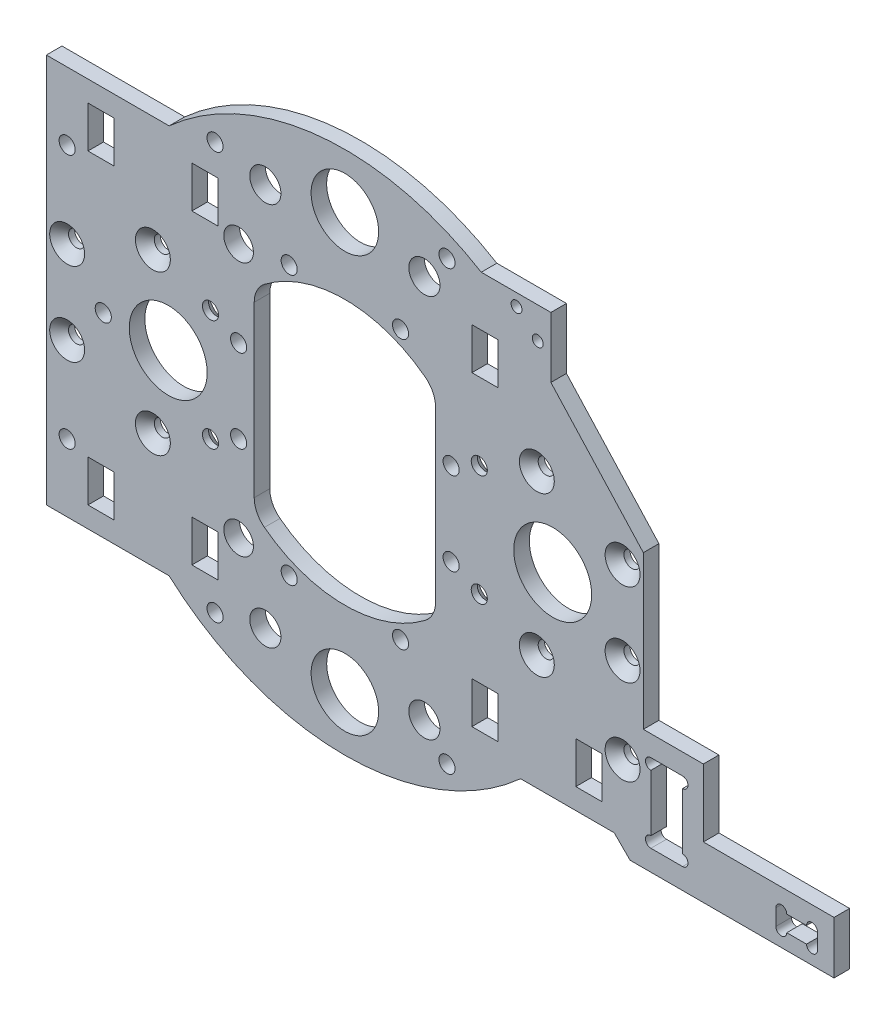
from build123d import *

# Parameters (mm, degrees)
SKETCH_1_R                  = 1.55
SKETCH_1_R_2                = 3
SKETCH_1_R_3                = 1.05
SKETCH_1_R_4                = 7.5
SKETCH_1_R_5                = 6.5
SKETCH_1_R_6                = 2.85
SKETCH_1_W                  = 5
SKETCH_1_H                  = 8
SKETCH_1_W_2                = 6.1
SKETCH_1_H_2                = 15.1
SKETCH_1_W_3                = 8
SKETCH_1_H_3                = 3.1
EXTRUDE_1_DEPTH             = 3
HOLE_WIZARD_M3_1_AT_2_COUNT = 2
HOLE_WIZARD_M3_1_AT_2_PITCH = 16
FILLET_1_R                  = 5
SKETCH_5_R                  = 1.05
CUT_EXTRUDE_1_DEPTH         = 10
SKETCH_7_R                  = 1.05
CUT_EXTRUDE_3_DEPTH         = 107.88064605


# Read off the part's stored shape, not the designer's step: M3 六角凹锥坑螺钉的锥形沉头孔2
with BuildPart() as part:
    # 草图1 → 凸台-拉伸1 (new body)
    with BuildSketch(Plane.XY):
        with BuildLine():
            Line((57.45, 12), (57.45, -12))
            Line((57.45, -12), (57.45, -17.45))
            Line((57.45, -17.45), (69, -17.45))
            Line((69, -17.45), (69, -30.45))
            Line((69, -30.45), (94.15, -30.45))
            Line((94.15, -30.45), (94.15, -40.55))
            Line((94.15, -40.55), (69, -40.55))
            Line((69, -40.55), (54.9, -40.55))
            Line((54.9, -40.55), (51.85, -37.5))
            Line((51.85, -37.5), (33.823069051, -37.5))
            ThreePointArc((33.823069051, -37.5), (0, -50.5), (-33.823069051, -37.5))
            Line((-33.823069051, -37.5), (-51.85, -37.5))
            Line((-51.85, -37.5), (-57.45, -37.5))
            Line((-57.45, -37.5), (-57.45, -17.45))
            Line((-57.45, -17.45), (-57.45, 17.45))
            Line((-57.45, 17.45), (-57.45, 37.5))
            Line((-57.45, 37.5), (-51.85, 37.5))
            Line((-51.85, 37.5), (-33.823069051, 37.5))
            ThreePointArc((-33.823069051, 37.5), (-4.723449629, 50.278613979), (26.246992614, 43.143312097))
            Line((26.246992614, 43.143312097), (39.651749171, 43.143312097))
            Line((39.651749171, 43.143312097), (39.651749171, 31.470777261))
            Line((39.651749171, 31.470777261), (57.45, 12))
        make_face()
        with Locations((-53.45, 24.5)):
            Circle(SKETCH_1_R, mode=Mode.SUBTRACT)
        with Locations((-53.45, -24.5)):
            Circle(SKETCH_1_R, mode=Mode.SUBTRACT)
        with Locations((-20.45, 8)):
            Circle(SKETCH_1_R, mode=Mode.SUBTRACT)
        with Locations((-20.45, -8)):
            Circle(SKETCH_1_R, mode=Mode.SUBTRACT)
        with Locations(Location((20.45, -8, 0), (0, 0, 180))):
            Circle(SKETCH_1_R, mode=Mode.SUBTRACT)
        with Locations(Location((20.45, 8, 0), (0, 0, 180))):
            Circle(SKETCH_1_R, mode=Mode.SUBTRACT)
        with Locations((53.45, 8)):
            Circle(SKETCH_1_R, mode=Mode.SUBTRACT)
        with Locations((53.45, -8)):
            Circle(SKETCH_1_R, mode=Mode.SUBTRACT)
        with Locations((-46.5, 0)):
            Circle(SKETCH_1_R, mode=Mode.SUBTRACT)
        with Locations((-24.984431788, 39.21770223)):
            Circle(SKETCH_1_R, mode=Mode.SUBTRACT)
        with Locations((19.651749171, 42.143312097)):
            Circle(SKETCH_1_R, mode=Mode.SUBTRACT)
        with Locations(Location((19.651749171, -42.143312097, 0), (0, 0, 180))):
            Circle(SKETCH_1_R, mode=Mode.SUBTRACT)
        with Locations(Location((-24.984431788, -39.21770223, 0), (0, 0, 180))):
            Circle(SKETCH_1_R, mode=Mode.SUBTRACT)
        with Locations((-10.715136106, 25.86862691)):
            Circle(SKETCH_1_R, mode=Mode.SUBTRACT)
        with Locations((10.715136106, 25.86862691)):
            Circle(SKETCH_1_R, mode=Mode.SUBTRACT)
        with Locations((25.86862691, 10.715136106)):
            Circle(SKETCH_1_R, mode=Mode.SUBTRACT)
        with Locations((25.86862691, -10.715136106)):
            Circle(SKETCH_1_R, mode=Mode.SUBTRACT)
        with Locations((10.715136106, -25.86862691)):
            Circle(SKETCH_1_R, mode=Mode.SUBTRACT)
        with Locations((-10.715136106, -25.86862691)):
            Circle(SKETCH_1_R, mode=Mode.SUBTRACT)
        with Locations((-25.86862691, -10.715136106)):
            Circle(SKETCH_1_R, mode=Mode.SUBTRACT)
        with Locations((-25.86862691, 10.715136106)):
            Circle(SKETCH_1_R, mode=Mode.SUBTRACT)
        with Locations((-36.95, 15.3)):
            Circle(SKETCH_1_R, mode=Mode.SUBTRACT)
        with Locations((-36.95, -15.3)):
            Circle(SKETCH_1_R, mode=Mode.SUBTRACT)
        with Locations(Location((36.95, -15.3, 0), (0, 0, 180))):
            Circle(SKETCH_1_R, mode=Mode.SUBTRACT)
        with Locations(Location((36.95, 15.3, 0), (0, 0, 180))):
            Circle(SKETCH_1_R, mode=Mode.SUBTRACT)
        with Locations((-15.307337295, 36.9551813)):
            Circle(SKETCH_1_R_2, mode=Mode.SUBTRACT)
        with Locations(Location((15.307337295, 36.9551813, 0), (0, 0, 180))):
            Circle(SKETCH_1_R_2, mode=Mode.SUBTRACT)
        with Locations(Location((-15.307337295, -36.9551813, 0), (0, 0, 180))):
            Circle(SKETCH_1_R_2, mode=Mode.SUBTRACT)
        with Locations((15.307337295, -36.9551813)):
            Circle(SKETCH_1_R_2, mode=Mode.SUBTRACT)
        with Locations((33.03932053, 40.800162976)):
            Circle(SKETCH_1_R_3, mode=Mode.SUBTRACT)
        with Locations((37.123106012, 37.123106012)):
            Circle(SKETCH_1_R_3, mode=Mode.SUBTRACT)
        with Locations((40, 0)):
            Circle(SKETCH_1_R_4, mode=Mode.SUBTRACT)
        with Locations((0, 40)):
            Circle(SKETCH_1_R_5, mode=Mode.SUBTRACT)
        with Locations(Location((0, -40, 0), (0, 0, 180))):
            Circle(SKETCH_1_R_5, mode=Mode.SUBTRACT)
        with Locations(Location((-53.45, -8, 0), (0, 0, 180))):
            Circle(SKETCH_1_R, mode=Mode.SUBTRACT)
        with Locations(Location((-53.45, 8, 0), (0, 0, 180))):
            Circle(SKETCH_1_R, mode=Mode.SUBTRACT)
        with Locations((-20.45, -24.5)):
            Circle(SKETCH_1_R_6, mode=Mode.SUBTRACT)
        with Locations(Location((-20.45, 24.5, 0), (0, 0, 180))):
            Circle(SKETCH_1_R_6, mode=Mode.SUBTRACT)
        with Locations(Location((53.45, -24.5, 0), (0, 0, 180))):
            Circle(SKETCH_1_R, mode=Mode.SUBTRACT)
        with Locations((-34, 0)):
            Circle(SKETCH_1_R_4, mode=Mode.SUBTRACT)
        with BuildLine():
            Line((-17.45, 18.594286757), (-17.45, -18.594286757))
            ThreePointArc((-17.45, -18.594286757), (0, -25.5), (17.45, -18.594286757))
            Line((17.45, -18.594286757), (17.45, 18.594286757))
            ThreePointArc((17.45, 18.594286757), (0, 25.5), (-17.45, 18.594286757))
        make_face(mode=Mode.SUBTRACT)
        with Locations((-26.95, -29.5)):
            Rectangle(SKETCH_1_W, SKETCH_1_H, mode=Mode.SUBTRACT)
        with Locations((-46.95, 29.5)):
            Rectangle(SKETCH_1_W, SKETCH_1_H, mode=Mode.SUBTRACT)
        with Locations((-46.95, -29.5)):
            Rectangle(SKETCH_1_W, SKETCH_1_H, mode=Mode.SUBTRACT)
        with Locations((-26.95, 29.5)):
            Rectangle(SKETCH_1_W, SKETCH_1_H, mode=Mode.SUBTRACT)
        with Locations((46.95, -29.5)):
            Rectangle(SKETCH_1_W, SKETCH_1_H, mode=Mode.SUBTRACT)
        with Locations((26.95, -29.5)):
            Rectangle(SKETCH_1_W, SKETCH_1_H, mode=Mode.SUBTRACT)
        with Locations((26.95, 29.5)):
            Rectangle(SKETCH_1_W, SKETCH_1_H, mode=Mode.SUBTRACT)
        with Locations((61.95, -29)):
            Rectangle(SKETCH_1_W_2, SKETCH_1_H_2, mode=Mode.SUBTRACT)
        with Locations((86.95, -36)):
            Rectangle(SKETCH_1_W_3, SKETCH_1_H_3, mode=Mode.SUBTRACT)
    extrude(amount=EXTRUDE_1_DEPTH)

    # 草图3 → M3 六角凹锥坑螺钉的锥形沉头孔1 (revolve, cut)
    with BuildSketch(Plane(origin=(-53.45, -8, 3), x_dir=(0, -1, 0), z_dir=(1, 0, 0))):
        Polygon((0, 0), (0, 3), (1.5, 3), (1.5, 1.86), (3.36, 0), align=None)
    hole_wizard_m3_1 = revolve(axis=Axis((-53.45, -8, 9.35), (0, 0, -1)), mode=Mode.SUBTRACT)

    # M3 六角凹锥坑螺钉的锥形沉头孔1 at 2: M3 六角凹锥坑螺钉的锥形沉头孔1 ×2
    with Locations(*[(0, i * HOLE_WIZARD_M3_1_AT_2_PITCH, 0) for i in range(1, HOLE_WIZARD_M3_1_AT_2_COUNT)]):
        add(hole_wizard_m3_1, mode=Mode.SUBTRACT)

    # 圆角1
    fillet_1_edges = [part.edges().sort_by_distance(p)[0] for p in [
        (17.45, 18.594286757, 1.5),
        (-17.45, 18.594286757, 1.5),
        (-17.45, -18.594286757, 1.5),
        (17.45, -18.594286757, 1.5),
    ]]
    fillet(fillet_1_edges, radius=FILLET_1_R)

    # M3 六角凹锥坑螺钉的锥形沉头孔2 outline → M3 六角凹锥坑螺钉的锥形沉头孔2 (revolve, cut)
    with BuildSketch(Plane(origin=(53.45, 8, 0), x_dir=(1, 0, 0), z_dir=(0, -1, 0))):
        Polygon((1.55, 3), (1.55, 1.19), (3.36, 3), align=None)
    revolve(axis=Axis((53.45, 8, 0), (0, 0, 1)), mode=Mode.SUBTRACT)

    # Hole Wizard M3 _2 2 outline → Hole Wizard M3 _2 2 (revolve, cut)
    with BuildSketch(Plane(origin=(53.45, -8, 0), x_dir=(1, 0, 0), z_dir=(0, -1, 0))):
        Polygon((1.55, 3), (1.55, 1.19), (3.36, 3), align=None)
    revolve(axis=Axis((53.45, -8, 0), (0, 0, 1)), mode=Mode.SUBTRACT)

    # Hole Wizard M3 _2 3 outline → Hole Wizard M3 _2 3 (revolve, cut)
    with BuildSketch(Plane(origin=(53.45, -24.5, 0), x_dir=(1, 0, 0), z_dir=(0, -1, 0))):
        Polygon((1.55, 3), (1.55, 1.19), (3.36, 3), align=None)
    revolve(axis=Axis((53.45, -24.5, 0), (0, 0, 1)), mode=Mode.SUBTRACT)

    # Hole Wizard M3 _2 4 outline → Hole Wizard M3 _2 4 (revolve, cut)
    with BuildSketch(Plane(origin=(-36.95, 15.3, 0), x_dir=(1, 0, 0), z_dir=(0, -1, 0))):
        Polygon((1.55, 3), (1.55, 1.19), (3.36, 3), align=None)
    revolve(axis=Axis((-36.95, 15.3, 0), (0, 0, 1)), mode=Mode.SUBTRACT)

    # Hole Wizard M3 _2 5 outline → Hole Wizard M3 _2 5 (revolve, cut)
    with BuildSketch(Plane(origin=(-36.95, -15.3, 0), x_dir=(1, 0, 0), z_dir=(0, -1, 0))):
        Polygon((1.55, 3), (1.55, 1.19), (3.36, 3), align=None)
    revolve(axis=Axis((-36.95, -15.3, 0), (0, 0, 1)), mode=Mode.SUBTRACT)

    # Hole Wizard M3 _2 6 outline → Hole Wizard M3 _2 6 (revolve, cut)
    with BuildSketch(Plane(origin=(36.95, 15.3, 0), x_dir=(1, 0, 0), z_dir=(0, -1, 0))):
        Polygon((1.55, 3), (1.55, 1.19), (3.36, 3), align=None)
    revolve(axis=Axis((36.95, 15.3, 0), (0, 0, 1)), mode=Mode.SUBTRACT)

    # Hole Wizard M3 _2 7 outline → Hole Wizard M3 _2 7 (revolve, cut)
    with BuildSketch(Plane(origin=(36.95, -15.3, 0), x_dir=(1, 0, 0), z_dir=(0, -1, 0))):
        Polygon((1.55, 3), (1.55, 1.19), (3.36, 3), align=None)
    revolve(axis=Axis((36.95, -15.3, 0), (0, 0, 1)), mode=Mode.SUBTRACT)

    # Hole Wizard M3 _2 8 outline → Hole Wizard M3 _2 8 (revolve, cut)
    with BuildSketch(Plane(origin=(25.86862691, 10.715136106, 0), x_dir=(1, 0, 0), z_dir=(0, -1, 0))):
        Polygon((3.36, 0), (1.55, 1.81), (1.55, 0), align=None)
    revolve(axis=Axis((25.86862691, 10.715136106, 0), (0, 0, 1)), mode=Mode.SUBTRACT)

    # Hole Wizard M3 _2 9 outline → Hole Wizard M3 _2 9 (revolve, cut)
    with BuildSketch(Plane(origin=(25.86862691, -10.715136106, 0), x_dir=(1, 0, 0), z_dir=(0, -1, 0))):
        Polygon((3.36, 0), (1.55, 1.81), (1.55, 0), align=None)
    revolve(axis=Axis((25.86862691, -10.715136106, 0), (0, 0, 1)), mode=Mode.SUBTRACT)

    # Hole Wizard M3 _2 10 outline → Hole Wizard M3 _2 10 (revolve, cut)
    with BuildSketch(Plane(origin=(-25.86862691, 10.715136106, 0), x_dir=(1, 0, 0), z_dir=(0, -1, 0))):
        Polygon((3.36, 0), (1.55, 1.81), (1.55, 0), align=None)
    revolve(axis=Axis((-25.86862691, 10.715136106, 0), (0, 0, 1)), mode=Mode.SUBTRACT)

    # Hole Wizard M3 _2 11 outline → Hole Wizard M3 _2 11 (revolve, cut)
    with BuildSketch(Plane(origin=(-25.86862691, -10.715136106, 0), x_dir=(1, 0, 0), z_dir=(0, -1, 0))):
        Polygon((3.36, 0), (1.55, 1.81), (1.55, 0), align=None)
    revolve(axis=Axis((-25.86862691, -10.715136106, 0), (0, 0, 1)), mode=Mode.SUBTRACT)

    # 草图5 → 切除-拉伸1 (cut)
    with BuildSketch(Plane(origin=(0, 0, 0), x_dir=(-1, 0, 0), z_dir=(0, 0, -1))):
        with Locations((-65, -35.5)):
            Circle(SKETCH_5_R)
        with Locations((-58.9, -35.5)):
            Circle(SKETCH_5_R)
        with Locations((-65, -22.5)):
            Circle(SKETCH_5_R)
        with Locations((-58.9, -22.5)):
            Circle(SKETCH_5_R)
    extrude(amount=-CUT_EXTRUDE_1_DEPTH, mode=Mode.SUBTRACT)

    # 草图7 → 切除-拉伸3 (cut, through all)
    with BuildSketch(Plane(origin=(0, 0, 0), x_dir=(-1, 0, 0), z_dir=(0, 0, -1))):
        with Locations((-89.9, -37.55)):
            Circle(SKETCH_7_R)
        with Locations((-89.9, -34.45)):
            Circle(SKETCH_7_R)
        with Locations((-84, -34.45)):
            Circle(SKETCH_7_R)
        with Locations((-84, -37.55)):
            Circle(SKETCH_7_R)
        with Locations((84, -37.55)):
            Circle(SKETCH_7_R)
        with Locations((84, -34.45)):
            Circle(SKETCH_7_R)
        with Locations((89.9, -34.45)):
            Circle(SKETCH_7_R)
        with Locations((89.9, -37.55)):
            Circle(SKETCH_7_R)
    extrude(amount=-CUT_EXTRUDE_3_DEPTH, mode=Mode.SUBTRACT)


solid = part.part
